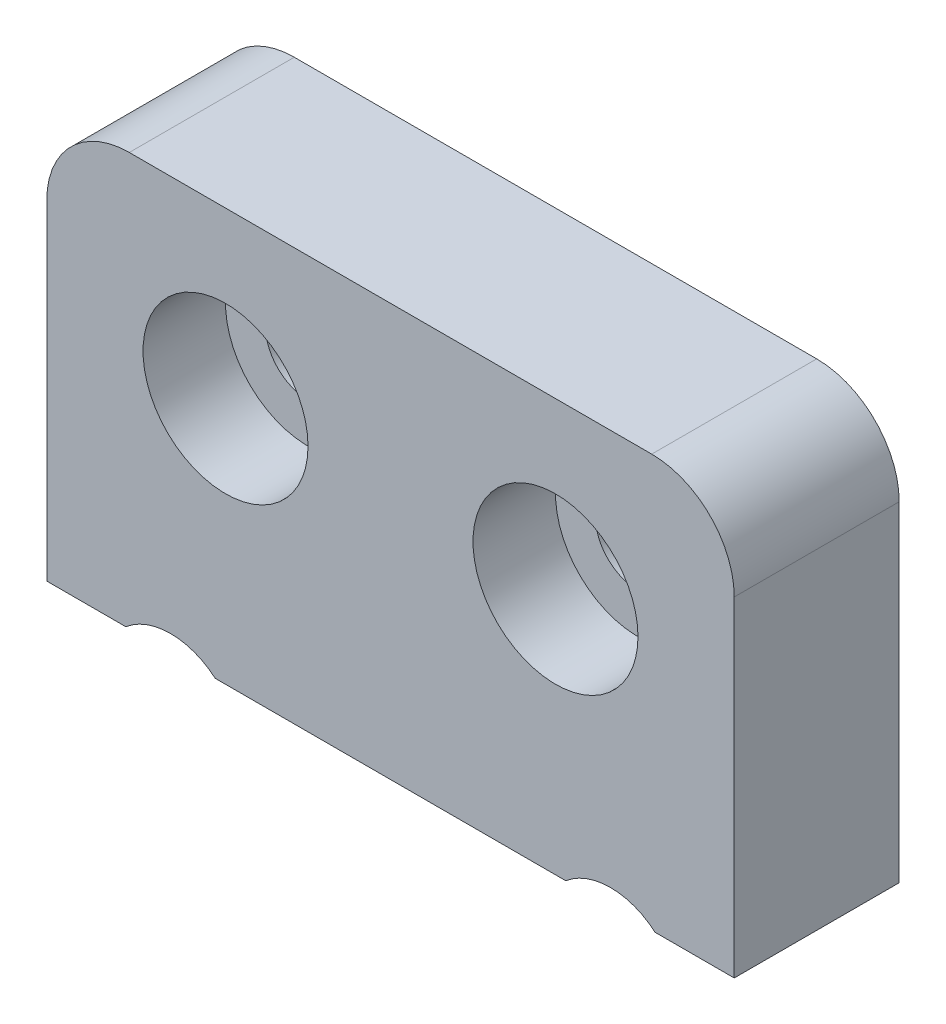
from build123d import *

# Parameters (mm, degrees)
SKETCH_1_W          = 25
SKETCH_1_H          = 15
SKETCH_1_R          = 1.55
EXTRUDE_1_DEPTH     = 6
SKETCH_3_R          = 1.5
CUT_EXTRUDE_1_DEPTH = 6
CUT_EXTRUDE_2_DEPTH = 30.765752132
FILLET_1_R          = 3
SKETCH_5_R          = 3
CUT_EXTRUDE_3_DEPTH = 3


with BuildPart() as part:
    # ｽｹｯﾁ1 → ﾎﾞｽ - 押し出し1 (new body)
    with BuildSketch(Plane.XY):
        with Locations((12.5, 7.5)):
            Rectangle(SKETCH_1_W, SKETCH_1_H)
        with Locations((6.5, 9)):
            Circle(SKETCH_1_R, mode=Mode.SUBTRACT)
        with Locations((18.5, 9)):
            Circle(SKETCH_1_R, mode=Mode.SUBTRACT)
    extrude(amount=EXTRUDE_1_DEPTH)

    # ｽｹｯﾁ3 → ｶｯﾄ - 押し出し1 (cut)
    with BuildSketch(Plane.XZ):
        with Locations((4.5, 3)):
            Circle(SKETCH_3_R)
        with Locations((20.5, 3)):
            Circle(SKETCH_3_R)
    extrude(amount=-CUT_EXTRUDE_1_DEPTH, mode=Mode.SUBTRACT)

    # ｽｹｯﾁ4 → ｶｯﾄ - 押し出し2 (cut, through all)
    with BuildSketch(Plane.XY.offset(6)):
        with BuildLine():
            Line((2.875192319, 0), (6.124807681, 0))
            ThreePointArc((6.124807681, 0), (4.5, 0.6), (2.875192319, 0))
        make_face()
        with BuildLine():
            Line((22.124807681, 0), (18.875192319, 0))
            ThreePointArc((18.875192319, 0), (20.5, 0.6), (22.124807681, 0))
        make_face()
    extrude(amount=-CUT_EXTRUDE_2_DEPTH, mode=Mode.SUBTRACT)

    # ﾌｨﾚｯﾄ1
    fillet_1_edges = [part.edges().sort_by_distance(p)[0] for p in [
        (0, 15, 3),
        (25, 15, 3),
    ]]
    fillet(fillet_1_edges, radius=FILLET_1_R)

    # ｽｹｯﾁ5 → ｶｯﾄ - 押し出し3 (cut)
    with BuildSketch(Plane.XY.offset(6)):
        with Locations((6.5, 9)):
            Circle(SKETCH_5_R)
        with Locations((18.5, 9)):
            Circle(SKETCH_5_R)
    extrude(amount=-CUT_EXTRUDE_3_DEPTH, mode=Mode.SUBTRACT)


solid = part.part
